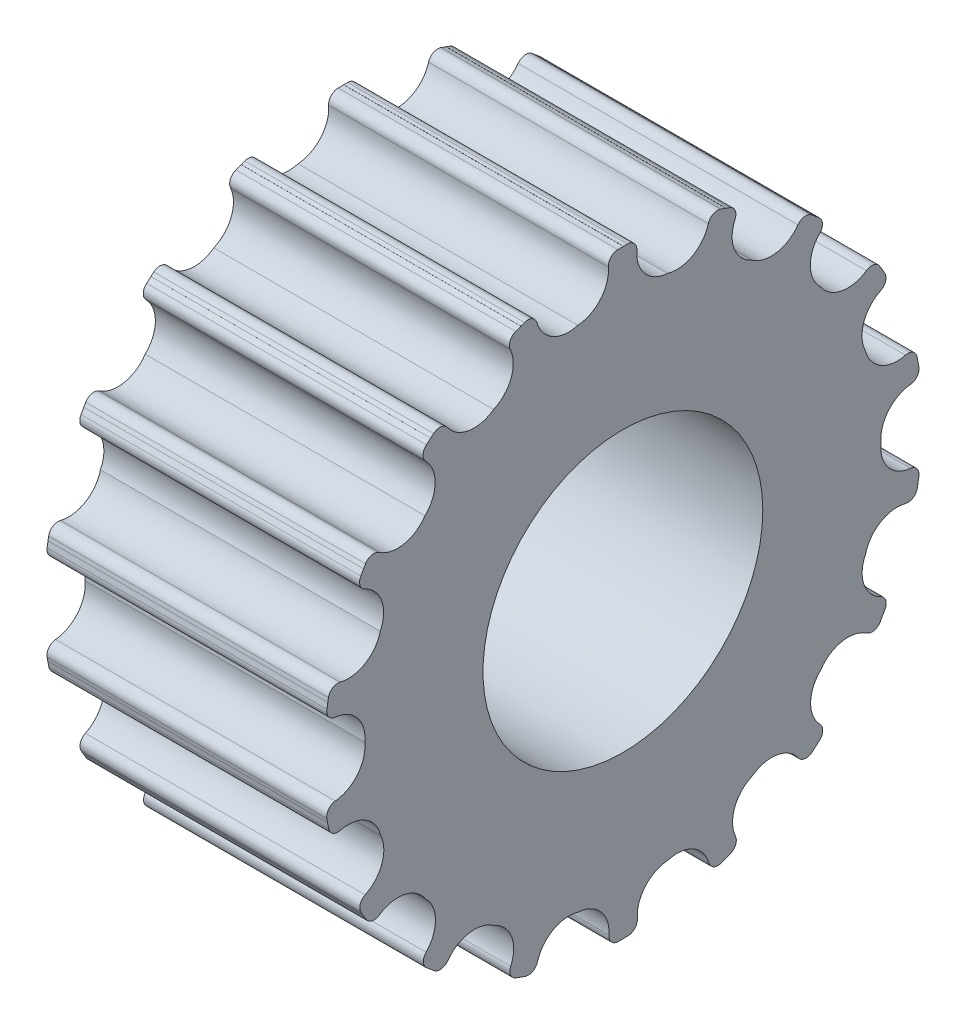
from build123d import *

# Parameters (mm, degrees)
SKETCH2_R               = 14.351
BOSS_EXTRUDE1_DEPTH     = 12.7
CUT_EXTRUDE2_DEPTH      = 24.980966462
CIRPATTERN1_COUNT       = 18
CUT_EXTRUDE3_DEPTH      = 23.999865205
CUT_EXTRUDE3_DEPTH_BACK = 23.999865205
SKETCH6_R               = 6.35


with BuildPart() as part:
    # Sketch2 → Boss-Extrude1 (new body)
    with BuildSketch(Plane(origin=(0, 0, 0), x_dir=(0, 0, -1), z_dir=(1, 0, 0))):
        with Locations((0, -0.065849568)):
            Circle(SKETCH2_R)
    extrude(amount=BOSS_EXTRUDE1_DEPTH)

    # Sketch5 → Cut-Extrude2 (cut, through all)
    with BuildSketch(Plane(origin=(12.7, 0, 0), x_dir=(0, 0, -1), z_dir=(1, 0, 0))):
        with BuildLine():
            Line((-0.049525325, 13.542284863), (0.204474675, 13.542284863))
            ThreePointArc((0.204474675, 13.542284863), (0.520233844, 13.404168654), (0.633149015, 13.078546013))
            ThreePointArc((0.633149015, 13.078546013), (0.992625559, 11.985736426), (2.023296586, 11.474685143))
            ThreePointArc((2.023296586, 11.474685143), (3.166600377, 11.60240601), (3.878160724, 12.506362896))
            ThreePointArc((3.878160724, 12.506362896), (4.09563578, 12.773728826), (4.439590867, 12.795519612))
            Line((4.439590867, 12.795519612), (4.678272792, 12.708646496))
            Line((4.678272792, 12.708646496), (4.975830317, 13.526179076))
            Line((4.975830317, 13.526179076), (2.541274675, 14.412284863))
            Line((2.541274675, 14.412284863), (-0.049525325, 14.412284863))
            Line((-0.049525325, 14.412284863), (-0.049525325, 13.542284863))
        make_face()
    cut_extrude2 = extrude(amount=-CUT_EXTRUDE2_DEPTH, mode=Mode.SUBTRACT)

    # CirPattern1: Cut-Extrude2 ×18 about axis
    cirpattern1_axis = Axis((12.7, -0.065849568, 0), (1, 0, 0))
    for i in range(1, CIRPATTERN1_COUNT):
        add(cut_extrude2.rotate(cirpattern1_axis, i * 360 / CIRPATTERN1_COUNT), mode=Mode.SUBTRACT)

    # Sketch6 → Cut-Extrude3 (cut, two sides: drawn at the far end of the back side and taken through both)
    with BuildSketch(Plane(origin=(12.7, 0, 0), x_dir=(0, 0, -1), z_dir=(1, 0, 0)).offset(-CUT_EXTRUDE3_DEPTH_BACK)):
        Circle(SKETCH6_R)
    extrude(amount=CUT_EXTRUDE3_DEPTH + CUT_EXTRUDE3_DEPTH_BACK, mode=Mode.SUBTRACT)


solid = part.part
